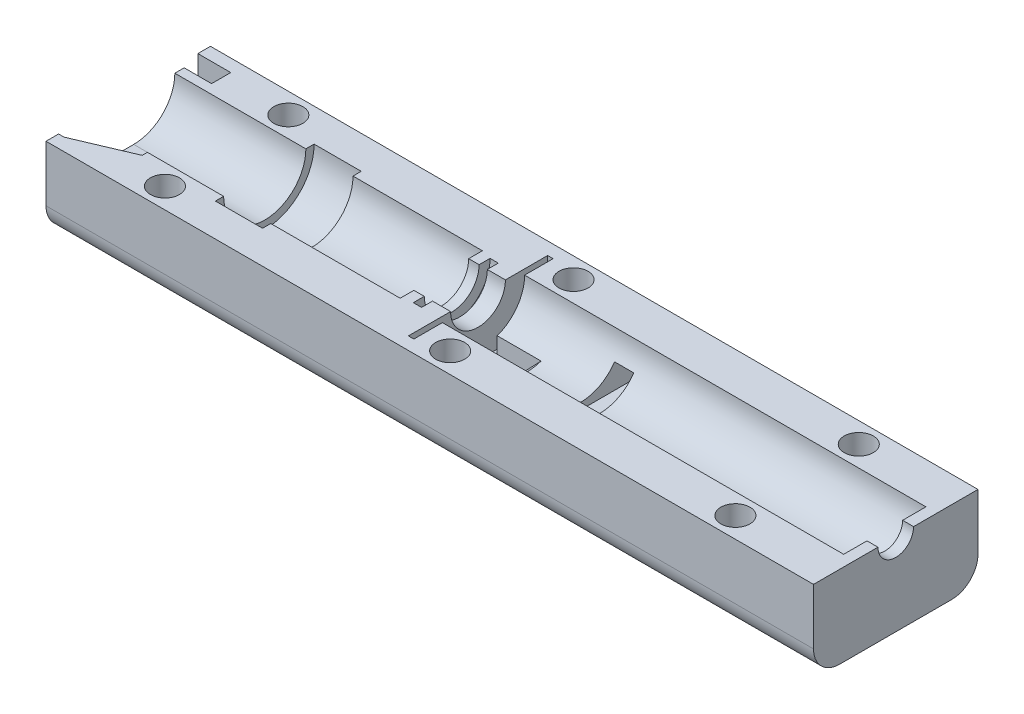
from build123d import *

# Parameters (mm, degrees)
SKETCH2_W             = 140
SKETCH2_H             = 15
BASE_DEPTH            = 15
SKETCH3_R             = 7.5
CENTER_CUT_DEPTH      = 142.598022585
SKETCH4_W             = 1
SKETCH4_H             = 25.4
ANTENNA_PCB_DEPTH     = 10.2
SKETCH11_W            = 3.5
SKETCH11_H            = 15
COAX_CONNECTOR_DEPTH  = 5
LENS_START            = -23.9
SKETCH8_R             = 9
LENS_DEPTH            = 8.6
FILLET1_R             = 4.8
SKETCH17_W            = 82.5
SKETCH17_H            = 3
CUT_EXTRUDE4_DEPTH    = 2
SKETCH19_W            = 4
SKETCH19_H            = 5.2
CUT_EXTRUDE5_DEPTH    = 5.8
SKETCH21_W            = 3.5
SKETCH21_H            = 4.5
CUT_EXTRUDE6_DEPTH    = 15
FILLET7_SIZE          = 1.5
COAX_CABLE_HOLE_START = -2
COAX_CABLE_HOLE_DEPTH = 2
SKETCH23_W            = 12.7
SKETCH23_H            = 7.5
CUT_EXTRUDE7_DEPTH    = 10
BOSS_EXTRUDE1_REACH   = 143.598
CUT_EXTRUDE10_DEPTH   = 2.7
SKETCH31_R            = 2.65
MOUNTING_HOLES_DEPTH  = 5
FILLET11_SIZE         = 2
PHOTODIODE_PCB_START  = -62.8
SKETCH10_W            = 25.4
SKETCH10_H            = 20.4
PHOTODIODE_PCB_DEPTH  = 1
CUT_EXTRUDE13_DEPTH   = 5
CHAMFER2_SIZE         = 3
FILTER_MOUNT_START    = -56.1
FILTER_MOUNT_DEPTH    = 6.7
FILTER_SPACE_START    = -58
SKETCH36_R            = 7
FILTER_SPACE_DEPTH    = 1.5


# Some blends are built 0.0001 mm under size
with BuildPart() as part:
    # Sketch2 → Base (new body)
    with BuildSketch(Plane(origin=(0, 0, 0), x_dir=(1, 0, 0), z_dir=(0, 1, 0))):
        with Locations((70, -7.5)):
            Rectangle(SKETCH2_W, SKETCH2_H)
        with Locations((70, 7.5)):
            Rectangle(SKETCH2_W, SKETCH2_H)
    extrude(amount=-BASE_DEPTH)

    # Sketch3 → Center_cut (cut, through all)
    with BuildSketch(Plane.ZY):
        Circle(SKETCH3_R)
    extrude(amount=-CENTER_CUT_DEPTH, mode=Mode.SUBTRACT)

    # Sketch4 → Antenna_PCB (cut)
    with BuildSketch(Plane(origin=(0, 0, 0), x_dir=(1, 0, 0), z_dir=(0, 1, 0))):
        with Locations((0.5, 0)):
            Rectangle(SKETCH4_W, SKETCH4_H)
    extrude(amount=-ANTENNA_PCB_DEPTH, mode=Mode.SUBTRACT)

    # Sketch11 → Coax_connector (cut)
    with BuildSketch(Plane.ZY.offset(-1)):
        with Locations((-10.95, 0)):
            Rectangle(SKETCH11_W, SKETCH11_H)
    extrude(amount=-COAX_CONNECTOR_DEPTH, mode=Mode.SUBTRACT)

    # Sketch8 → Lens (cut)
    with BuildSketch(Plane.ZY.offset(-1).offset(LENS_START)):
        Circle(SKETCH8_R)
    extrude(amount=-LENS_DEPTH, mode=Mode.SUBTRACT)

    # Fillet1
    fillet1_edges = [part.edges().sort_by_distance(p)[0] for p in [
        (70, -15, -15),
        (70, -15, 15),
    ]]
    fillet(fillet1_edges, radius=FILLET1_R)

    # Sketch17 → Cut-Extrude4 (cut)
    with BuildSketch(Plane(origin=(0, 0, -15), x_dir=(-1, 0, 0), z_dir=(0, 0, -1))):
        with Locations((-44.75, -8.7)):
            Rectangle(SKETCH17_W, SKETCH17_H)
    extrude(amount=-CUT_EXTRUDE4_DEPTH, mode=Mode.SUBTRACT)

    # Sketch19 → Cut-Extrude5 (cut)
    with BuildSketch(Plane(origin=(0, 0, -15), x_dir=(-1, 0, 0), z_dir=(0, 0, -1))):
        with Locations((-5.5, -7.6)):
            Rectangle(SKETCH19_W, SKETCH19_H)
    extrude(amount=-CUT_EXTRUDE5_DEPTH, mode=Mode.SUBTRACT)

    # Sketch21 → Cut-Extrude6 (cut)
    with BuildSketch(Plane(origin=(0, 0, -15), x_dir=(-1, 0, 0), z_dir=(0, 0, -1))):
        with Locations((-84.25, -6.45)):
            Rectangle(SKETCH21_W, SKETCH21_H)
    extrude(amount=-CUT_EXTRUDE6_DEPTH, mode=Mode.SUBTRACT)

    # Fillet7
    fillet7_edges = [part.edges().sort_by_distance(p)[0] for p in [
        (84.25, -8.7, -13),
    ]]
    chamfer(fillet7_edges, length=FILLET7_SIZE - 0.0001)  # a hair under: the kernel refuses the full size

    # Sketch22 → Coax_cable_hole (add)
    with BuildSketch(Plane(origin=(140, 0, 0), x_dir=(0, 0, -1), z_dir=(1, 0, 0)).offset(COAX_CABLE_HOLE_START)):
        with BuildLine():
            ThreePointArc((-7.5, 0), (0, -7.5), (7.5, 0))
            Line((7.5, 0), (3.25, 0))
            ThreePointArc((3.25, 0), (0, -3.25), (-3.25, 0))
            Line((-3.25, 0), (-7.5, 0))
        make_face()
        with BuildLine():
            Line((11.25, -8), (11.25, 0))
            Line((11.25, 0), (7.5, 0))
            ThreePointArc((7.5, 0), (0, -7.5), (-7.5, 0))
            Line((-7.5, 0), (-11.25, 0))
            Line((-11.25, 0), (-11.25, -8))
            Line((-11.25, -8), (11.25, -8))
        make_face()
    extrude(amount=COAX_CABLE_HOLE_DEPTH)

    # Sketch23 → Cut-Extrude7 (cut)
    with BuildSketch(Plane.ZY.offset(-1)):
        with Locations((6.35, -3.75)):
            Rectangle(SKETCH23_W, SKETCH23_H)
    extrude(amount=-CUT_EXTRUDE7_DEPTH, mode=Mode.SUBTRACT)

    # Sketch24 → Boss-Extrude1 (add, up to next)
    with BuildSketch(Plane(origin=(0, 0, 0), x_dir=(1, 0, 0), z_dir=(0, 1, 0)), mode=Mode.PRIVATE) as boss_extrude1_sk1:
        Polygon((1, -12.7), (11, -8.455251838), (11, -12.7), align=None)
    boss_extrude1_tool1 = extrude(boss_extrude1_sk1.sketch, amount=-BOSS_EXTRUDE1_REACH, mode=Mode.PRIVATE) - part.part
    add(boss_extrude1_tool1.solids().sort_by_distance((7.666667, 0, 11.285084))[0])

    # Sketch27 → Cut-Extrude10 (cut)
    with BuildSketch(Plane(origin=(0, -7.5, 0), x_dir=(1, 0, 0), z_dir=(0, 1, 0))):
        Polygon((10.687415097, -7.718847955), (11, -8.455251838), (11, -7.586163536), align=None)
        Polygon((1, -12.7), (11, -8.455251838), (10.687415097, -7.718847955), (1, -11.830911698), align=None)
    extrude(amount=-CUT_EXTRUDE10_DEPTH, mode=Mode.SUBTRACT)

    # Sketch31 → Mounting_holes (cut)
    with BuildSketch(Plane(origin=(0, 0, 0), x_dir=(1, 0, 0), z_dir=(0, 1, 0))):
        with Locations(Location((17.95, -11.25, 0), (0, 0, 270))):
            Circle(SKETCH31_R)
        with Locations(Location((122, -11.25, 0), (0, 0, 270))):
            Circle(SKETCH31_R)
        with Locations(Location((122, 11.25, 0), (0, 0, 90))):
            Circle(SKETCH31_R)
        with Locations(Location((17.95, 11.25, 0), (0, 0, 90))):
            Circle(SKETCH31_R)
        with Locations(Location((69.975, -11.25, 0), (0, 0, 270))):
            Circle(SKETCH31_R)
        with Locations(Location((69.975, 11.25, 0), (0, 0, 90))):
            Circle(SKETCH31_R)
    extrude(amount=-MOUNTING_HOLES_DEPTH, mode=Mode.SUBTRACT)

    # Fillet11
    fillet11_edges = [part.edges().sort_by_distance(p)[0] for p in [
        (7.5, -8.7, -13),
        (3.5, -7.5, -10.95),
    ]]
    chamfer(fillet11_edges, length=FILLET11_SIZE)

    # Sketch10 → Photodiode_PCB (cut)
    with BuildSketch(Plane.ZY.offset(-1).offset(PHOTODIODE_PCB_START)):
        Rectangle(SKETCH10_W, SKETCH10_H)
    extrude(amount=-PHOTODIODE_PCB_DEPTH, mode=Mode.SUBTRACT)

    # Sketch33 → Cut-Extrude13 (cut)
    with BuildSketch(Plane.ZY.offset(-64.8)):
        with BuildLine():
            Line((-2.5, -10.2), (0, -10.2))
            Line((0, -10.2), (0, -7.5))
            ThreePointArc((0, -7.5), (-1.26826484, -7.391989197), (-2.5, -7.071067812))
            Line((-2.5, -7.071067812), (-2.5, -10.2))
        make_face()
        with BuildLine():
            Line((0, -10.2), (2.5, -10.2))
            Line((2.5, -10.2), (2.5, -7.071067812))
            ThreePointArc((2.5, -7.071067812), (1.26826484, -7.391989197), (0, -7.5))
            Line((0, -7.5), (0, -10.2))
        make_face()
    extrude(amount=-CUT_EXTRUDE13_DEPTH, mode=Mode.SUBTRACT)

    # Chamfer2
    # the kernel refuses this chamfer: 3 mm, written as the material it takes off along each edge
    with BuildSketch(Plane(origin=(69.8, 0, 0), x_dir=(0, -0.2008336879156208, 0.9796253517535216), z_dir=(0, 0.9796253517535216, 0.2008336879156208))) as chamfer2_piece_1_section:
        Polygon((7.5, CHAMFER2_SIZE), (7.5 + CHAMFER2_SIZE, 0), (7.5, 0), align=None)
    chamfer2_piece_1 = revolve(axis=Axis((69.8, 0, 0), (1, 0, 0)), revolution_arc=156.828569884, mode=Mode.PRIVATE)
    chamfer2_piece_1 = split(chamfer2_piece_1, bisect_by=Plane(origin=(70.802116042, -8.337432159, -2.5), z_dir=(0, 0, 1)), keep=Keep.TOP, mode=Mode.PRIVATE)
    chamfer2_piece_1 = split(chamfer2_piece_1, bisect_by=Plane(origin=(70.802116042, -10.2, 0), z_dir=(0, 1, 0)), keep=Keep.TOP, mode=Mode.PRIVATE)
    chamfer2_piece_1 = split(chamfer2_piece_1, bisect_by=Plane(origin=(70.802116042, -8.337432159, 2.5), z_dir=(0, 0, -1)), keep=Keep.TOP, mode=Mode.PRIVATE)
    add(chamfer2_piece_1, mode=Mode.SUBTRACT)

    # Sketch35 → Filter_mount (add)
    with BuildSketch(Plane.ZY.offset(-1).offset(FILTER_MOUNT_START)):
        with BuildLine():
            Line((-5, 0), (-7.5, 0))
            ThreePointArc((-7.5, 0), (-5.303300859, -5.303300859), (0, -7.5))
            ThreePointArc((0, -7.5), (5.303300859, -5.303300859), (7.5, 0))
            Line((7.5, 0), (5, 0))
            ThreePointArc((5, 0), (0, -5), (-5, 0))
        make_face()
    extrude(amount=-FILTER_MOUNT_DEPTH)

    # Sketch36 → Filter_space (cut)
    with BuildSketch(Plane.ZY.offset(-1).offset(FILTER_SPACE_START)):
        Circle(SKETCH36_R)
    extrude(amount=-FILTER_SPACE_DEPTH, mode=Mode.SUBTRACT)


solid = part.part
